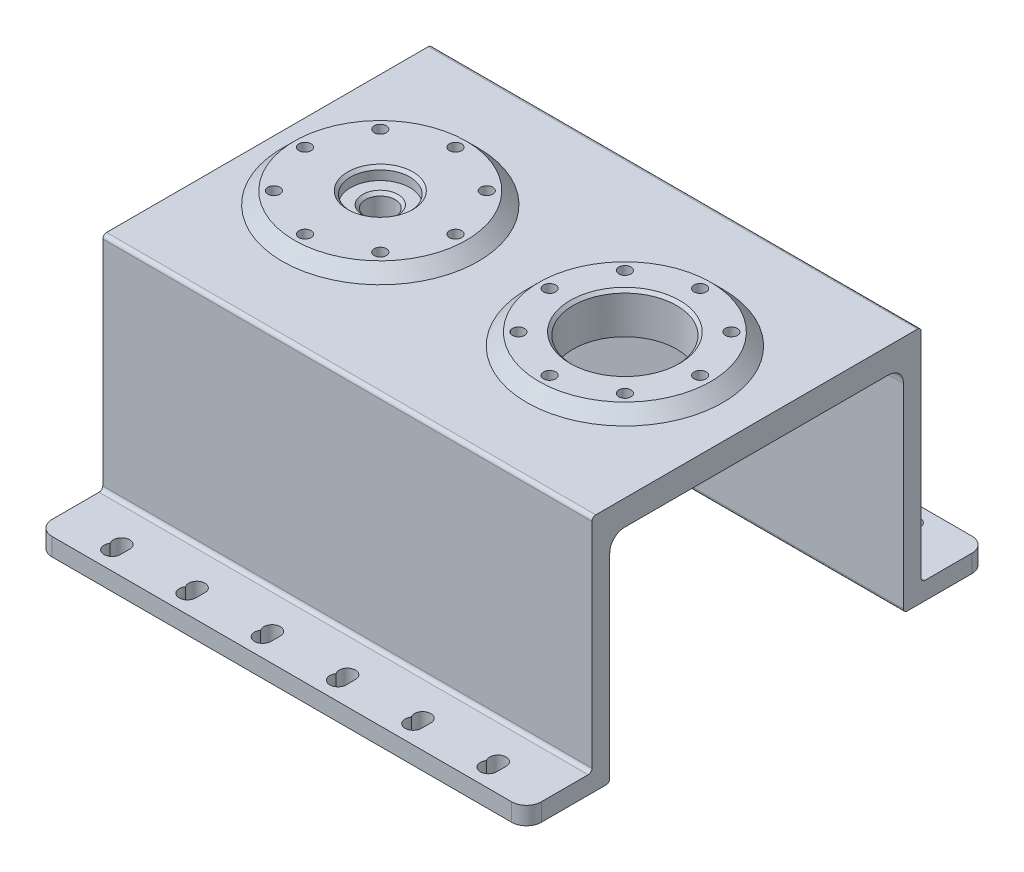
from build123d import *

# Parameters (mm, degrees)
BOSS_EXTRUDE1_DEPTH        = 44.45
BOSS_EXTRUDE1_DEPTH_BACK   = 120.65
SKETCH5_W                  = 99.125
SKETCH5_H                  = 72.176
BOSS_EXTRUDE2_DEPTH        = 1.5
CUT_EXTRUDE1_DEPTH         = 101.6
SKETCH12_R                 = 29
BOSS_EXTRUDE3_DEPTH        = 4.1
CHAMFER1_SIZE              = 4.1
SKETCH10_R                 = 2.05
CUT_EXTRUDE2_DEPTH         = 164.686388977
BOSS_EXTRUDE4_START        = -8.5
SKETCH17_R                 = 19.05
BOSS_EXTRUDE4_DEPTH        = 9.652
SKETCH13_R                 = 17.4625
CUT_EXTRUDE4_DEPTH         = 164.686388977
CHAMFER3_SIZE              = 1
LPATTERN1_COUNT            = 2
LPATTERN1_PITCH            = 82.55
CHAMFER1_OF_LPATTERN1_SIZE = 4.1
SKETCH14_R                 = 5
CUT_EXTRUDE5_DEPTH         = 164.686388977
SKETCH15_R                 = 10
CUT_EXTRUDE6_DEPTH         = 4.1
FILLET1_R                  = 1.27
FILLET3_R                  = 5
CHAMFER4_SIZE              = 1
CHAMFER5_SIZE              = 3
CHAMFER5_SIZE2             = 2.517298894


# Some blends are built 0.0001 mm under size
with BuildPart() as part:
    # Sketch2 → Boss-Extrude1 (new, two sides: drawn at the far end of the back side and taken through both)
    with BuildSketch(Plane(origin=(0, 0, 0), x_dir=(0, 0, -1), z_dir=(1, 0, 0)).offset(-BOSS_EXTRUDE1_DEPTH_BACK)):
        Polygon((-77.6605, 0), (-55.5625, 0), (-55.5625, 74.676), (55.5625, 74.676), (55.5625, 0), (77.6605, 0), (77.6605, -6), (49.5625, -6), (49.5625, 66.176), (-49.5625, 66.176), (-49.5625, -6), (-77.6605, -6), align=None)
    extrude(amount=BOSS_EXTRUDE1_DEPTH + BOSS_EXTRUDE1_DEPTH_BACK)

    # Sketch5 → Boss-Extrude2 (add)
    with BuildSketch(Plane.ZY.offset(120.65)):
        with Locations((0, 30.088)):
            Rectangle(SKETCH5_W, SKETCH5_H)
    extrude(amount=-BOSS_EXTRUDE2_DEPTH)

    # Sketch4 → Cut-Extrude1 (cut)
    with BuildSketch(Plane(origin=(0, 0, 0), x_dir=(1, 0, 0), z_dir=(0, 1, 0))):
        with BuildLine():
            Line((-98.85, 68.2625), (-98.85, 71.4375))
            ThreePointArc((-98.85, 71.4375), (-102.432865533, 74.058346238), (-103.845516366, 69.85))
            ThreePointArc((-103.845516366, 69.85), (-102.432865533, 65.641653762), (-98.85, 68.2625))
        make_face()
        with BuildLine():
            Line((-73.45, 68.2625), (-73.45, 71.4375))
            ThreePointArc((-73.45, 71.4375), (-77.032865533, 74.058346238), (-78.445516366, 69.85))
            ThreePointArc((-78.445516366, 69.85), (-77.032865533, 65.641653762), (-73.45, 68.2625))
        make_face()
        with BuildLine():
            Line((-48.05, 68.2625), (-48.05, 71.4375))
            ThreePointArc((-48.05, 71.4375), (-51.632865533, 74.058346238), (-53.045516366, 69.85))
            ThreePointArc((-53.045516366, 69.85), (-51.632865533, 65.641653762), (-48.05, 68.2625))
        make_face()
        with BuildLine():
            Line((-22.65, 68.2625), (-22.65, 71.4375))
            ThreePointArc((-22.65, 71.4375), (-26.232865533, 74.058346238), (-27.645516366, 69.85))
            ThreePointArc((-27.645516366, 69.85), (-26.232865533, 65.641653762), (-22.65, 68.2625))
        make_face()
        with BuildLine():
            Line((2.75, 68.2625), (2.75, 71.4375))
            ThreePointArc((2.75, 71.4375), (-0.832865533, 74.058346238), (-2.245516366, 69.85))
            ThreePointArc((-2.245516366, 69.85), (-0.832865533, 65.641653762), (2.75, 68.2625))
        make_face()
        with BuildLine():
            Line((28.15, 68.2625), (28.15, 71.4375))
            ThreePointArc((28.15, 71.4375), (24.567134467, 74.058346238), (23.154483634, 69.85))
            ThreePointArc((23.154483634, 69.85), (24.567134467, 65.641653762), (28.15, 68.2625))
        make_face()
    cut_extrude1 = extrude(amount=-CUT_EXTRUDE1_DEPTH, mode=Mode.SUBTRACT)

    # Mirror1: Cut-Extrude1 across plane
    add(cut_extrude1.mirror(Plane.XY), mode=Mode.SUBTRACT)

    # Sketch12 → Boss-Extrude3 (add)
    with BuildSketch(Plane(origin=(0, 74.676, 0), x_dir=(1, 0, 0), z_dir=(0, 1, 0))):
        with Locations(Location((0, 0, 0), (0, 0, 270))):
            Circle(SKETCH12_R)
    boss_extrude3 = extrude(amount=BOSS_EXTRUDE3_DEPTH)

    # Chamfer1
    chamfer1_edges = [part.edges().sort_by_distance(p)[0] for p in [
        (0, 74.676, -29),
    ]]
    chamfer(chamfer1_edges, length=CHAMFER1_SIZE - 0.0001)  # a hair under: the kernel refuses the full size

    # Sketch10 → Cut-Extrude2 (cut, symmetric)
    with BuildSketch(Plane(origin=(0, 0, 0), x_dir=(1, 0, 0), z_dir=(0, 1, 0))):
        with Locations(Location((17.960512242, 17.960512242, 0), (0, 0, 270))):
            Circle(SKETCH10_R)
        with Locations(Location((25.4, 0, 0), (0, 0, 270))):
            Circle(SKETCH10_R)
        with Locations(Location((17.960512242, -17.960512242, 0), (0, 0, 270))):
            Circle(SKETCH10_R)
        with Locations(Location((0, -25.4, 0), (0, 0, 270))):
            Circle(SKETCH10_R)
        with Locations(Location((-17.960512242, -17.960512242, 0), (0, 0, 270))):
            Circle(SKETCH10_R)
        with Locations(Location((-25.4, 0, 0), (0, 0, 270))):
            Circle(SKETCH10_R)
        with Locations(Location((-17.960512242, 17.960512242, 0), (0, 0, 270))):
            Circle(SKETCH10_R)
        with Locations(Location((0, 25.4, 0), (0, 0, 270))):
            Circle(SKETCH10_R)
    cut_extrude2 = extrude(amount=CUT_EXTRUDE2_DEPTH, both=True, mode=Mode.SUBTRACT)

    # Sketch17 → Boss-Extrude4 (add)
    with BuildSketch(Plane.XZ.offset(-66.176).offset(BOSS_EXTRUDE4_START)):
        with Locations(Location((0, 0, 0), (0, 0, 90))):
            Circle(SKETCH17_R)
    extrude(amount=BOSS_EXTRUDE4_DEPTH)

    # Sketch13 → Cut-Extrude4 (cut, through all)
    with BuildSketch(Plane(origin=(0, 0, 0), x_dir=(1, 0, 0), z_dir=(0, 1, 0))):
        with Locations(Location((0, 0, 0), (0, 0, 90))):
            Circle(SKETCH13_R)
    extrude(amount=CUT_EXTRUDE4_DEPTH, mode=Mode.SUBTRACT)

    # Chamfer3
    chamfer3_edges = [part.edges().sort_by_distance(p)[0] for p in [
        (0, 66.176, -19.05),
    ]]
    chamfer(chamfer3_edges, length=CHAMFER3_SIZE)

    # LPattern1: Boss-Extrude3, Cut-Extrude2 ×2
    with Locations(*[(-i * LPATTERN1_PITCH, 0, 0) for i in range(1, LPATTERN1_COUNT)]):
        add(boss_extrude3)
        add(cut_extrude2, mode=Mode.SUBTRACT)

    # Chamfer1 of LPattern1
    chamfer1_of_lpattern1_edges = [part.edges().sort_by_distance(p)[0] for p in [
        (-82.55, 74.676, -29),
    ]]
    chamfer(chamfer1_of_lpattern1_edges, length=CHAMFER1_OF_LPATTERN1_SIZE - 0.0001)  # a hair under: the kernel refuses the full size

    # Sketch14 → Cut-Extrude5 (cut, through all)
    with BuildSketch(Plane(origin=(0, 0, 0), x_dir=(1, 0, 0), z_dir=(0, 1, 0))):
        with Locations(Location((-82.55, 0, 0), (0, 0, 270))):
            Circle(SKETCH14_R)
    extrude(amount=CUT_EXTRUDE5_DEPTH, mode=Mode.SUBTRACT)

    # Sketch15 → Cut-Extrude6 (cut)
    with BuildSketch(Plane(origin=(0, 78.776, 0), x_dir=(1, 0, 0), z_dir=(0, 1, 0))):
        with Locations(Location((-82.55, 0, 0), (0, 0, 270))):
            Circle(SKETCH15_R)
    extrude(amount=-CUT_EXTRUDE6_DEPTH, mode=Mode.SUBTRACT)

    # Fillet1
    fillet1_edges = [part.edges().sort_by_distance(p)[0] for p in [
        (-38.1, 0, -55.5625),
        (-38.1, 74.676, -55.5625),
        (-38.1, 74.676, 55.5625),
        (-38.1, 0, 55.5625),
        (-37.35, -6, 49.5625),
        (-37.35, -6, -49.5625),
    ]]
    fillet(fillet1_edges, radius=FILLET1_R)

    # Fillet3
    # the kernel refuses this fillet: 5 mm, written as the material it adds along each edge
    with BuildSketch(Plane(origin=(-114.15, 61.176, 44.5625), x_dir=(0, 1, 0), z_dir=(-1, 0, 0))) as fillet3_piece_1_section:
        Polygon((0, 0), (FILLET3_R * 1.02, 0), (FILLET3_R * 1.02, -FILLET3_R * 1.02), (0, -FILLET3_R * 1.02), align=None)
    fillet3_piece_1 = extrude(amount=FILLET3_R * 1.02, mode=Mode.PRIVATE)
    fillet3_piece_1 = fillet3_piece_1 - Plane(origin=(-114.15, 61.176, 44.5625), x_dir=(0, -0.7071067811865475, -0.7071067811865475), z_dir=(-1, 0, 0)) * Sphere(FILLET3_R, mode=Mode.PRIVATE)
    add(fillet3_piece_1)
    with BuildSketch(Plane(origin=(-114.15, 61.176, -44.5625), x_dir=(-1, 0, 0), z_dir=(0, 1, 0))) as fillet3_piece_2_section:
        Polygon((0, 0), (FILLET3_R * 1.02, 0), (FILLET3_R * 1.02, -FILLET3_R * 1.02), (0, -FILLET3_R * 1.02), align=None)
    fillet3_piece_2 = extrude(amount=FILLET3_R * 1.02, mode=Mode.PRIVATE)
    fillet3_piece_2 = fillet3_piece_2 - Plane(origin=(-114.15, 61.176, -44.5625), x_dir=(0.7071067811865475, 0, 0.7071067811865475), z_dir=(0, 1, 0)) * Sphere(FILLET3_R, mode=Mode.PRIVATE)
    add(fillet3_piece_2)
    with BuildSketch(Plane(origin=(-119.15, -4.73, 49.5625), x_dir=(1, 0, 0), z_dir=(0, 1, 0))) as fillet3_piece_3:
        with BuildLine():
            CenterArc((FILLET3_R, FILLET3_R), FILLET3_R, 180, 90)
            Line((0, FILLET3_R), (0, 0))
            Line((0, 0), (FILLET3_R, 0))
        make_face()
    extrude(amount=65.906)
    with BuildSketch(Plane(origin=(-119.15, -4.73, -50.8325), x_dir=(0, 0.006283143965557515, 0.9999802608561371), z_dir=(0, -0.9999802608561371, 0.006283143965557515))) as fillet3_piece_4_section:
        with BuildLine():
            CenterArc((-1.27 - FILLET3_R, -FILLET3_R), FILLET3_R, 0, 90)
            Line((-1.27 - FILLET3_R, 0), (-1.27, 0))
            Line((-1.27, 0), (-1.27, -FILLET3_R))
        make_face()
    fillet3_piece_4 = revolve(axis=Axis((-119.15, -4.73, -50.8325), (-1, 0, 0)), revolution_arc=359.64, mode=Mode.PRIVATE)
    fillet3_piece_4 = split(fillet3_piece_4, bisect_by=Plane(origin=(-117.187917089, -6, -49.859640049), z_dir=(0, 1, 0)), keep=Keep.TOP, mode=Mode.PRIVATE)
    add(fillet3_piece_4)
    with BuildSketch(Plane(origin=(-119.15, -4.73, 50.8325), x_dir=(0, 0.006283143965559613, -0.9999802608561371), z_dir=(0, -0.9999802608561371, -0.006283143965559613))) as fillet3_piece_5_section:
        with BuildLine():
            CenterArc((-1.27 - FILLET3_R, FILLET3_R), FILLET3_R, 270, 90)
            Line((-1.27 - FILLET3_R, 0), (-1.27, 0))
            Line((-1.27, 0), (-1.27, FILLET3_R))
        make_face()
    fillet3_piece_5 = revolve(axis=Axis((-119.15, -4.73, 50.8325), (1, 0, 0)), revolution_arc=359.64, mode=Mode.PRIVATE)
    fillet3_piece_5 = split(fillet3_piece_5, bisect_by=Plane(origin=(-117.187917089, -6, 49.85964009), z_dir=(0, 1, 0)), keep=Keep.TOP, mode=Mode.PRIVATE)
    add(fillet3_piece_5)
    with BuildSketch(Plane(origin=(44.45, 66.176, 49.5625), x_dir=(0, 0, -1), z_dir=(-1, 0, 0))) as fillet3_piece_6:
        with BuildLine():
            CenterArc((FILLET3_R, FILLET3_R), FILLET3_R, 180, 90)
            Line((0, FILLET3_R), (0, 0))
            Line((0, 0), (FILLET3_R, 0))
        make_face()
    extrude(amount=158.6)
    with BuildSketch(Plane(origin=(44.45, 66.176, -49.5625), x_dir=(0, 0, 1), z_dir=(-1, 0, 0))) as fillet3_piece_7:
        with BuildLine():
            CenterArc((FILLET3_R, -FILLET3_R), FILLET3_R, 90, 90)
            Line((0, -FILLET3_R), (0, 0))
            Line((0, 0), (FILLET3_R, 0))
        make_face()
    extrude(amount=158.6)
    with BuildSketch(Plane(origin=(-119.15, 61.176, -49.5625), x_dir=(0, 0, 1), z_dir=(0, -1, 0))) as fillet3_piece_8:
        with BuildLine():
            CenterArc((FILLET3_R, -FILLET3_R), FILLET3_R, 90, 90)
            Line((0, -FILLET3_R), (0, 0))
            Line((0, 0), (FILLET3_R, 0))
        make_face()
    extrude(amount=65.906)
    with BuildSketch(Plane(origin=(-119.15, 66.176, 44.5625), x_dir=(1, 0, 0), z_dir=(0, 0, -1))) as fillet3_piece_9:
        with BuildLine():
            CenterArc((FILLET3_R, FILLET3_R), FILLET3_R, 180, 90)
            Line((0, FILLET3_R), (0, 0))
            Line((0, 0), (FILLET3_R, 0))
        make_face()
    extrude(amount=89.125)
    # the kernel refuses this fillet: 5 mm, written as the material it takes off along each edge
    with BuildSketch(Plane(origin=(-120.65, 12.5, -77.6605), x_dir=(0, 0, 1), z_dir=(0, -1, 0)), Plane(origin=(-120.65, -18.5, 77.6605), x_dir=(0, 0, -1), z_dir=(0, 1, 0))) as fillet3_2_piece_1:
        with BuildLine():
            CenterArc((FILLET3_R, -FILLET3_R), FILLET3_R, 90, 90)
            Line((0, -FILLET3_R), (0, 0))
            Line((0, 0), (FILLET3_R, 0))
        make_face()
    extrude(amount=31, mode=Mode.SUBTRACT)
    with BuildSketch(Plane(origin=(44.45, -18.5, 77.6605), x_dir=(0, 0, -1), z_dir=(0, 1, 0)), Plane(origin=(44.45, 12.5, -77.6605), x_dir=(0, 0, 1), z_dir=(0, -1, 0))) as fillet3_2_piece_2:
        with BuildLine():
            CenterArc((FILLET3_R, FILLET3_R), FILLET3_R, 180, 90)
            Line((0, FILLET3_R), (0, 0))
            Line((0, 0), (FILLET3_R, 0))
        make_face()
    extrude(amount=31, mode=Mode.SUBTRACT)

    # Chamfer4
    chamfer4_edges = [part.edges().sort_by_distance(p)[0] for p in [
        (0, 78.776, 17.4625),
        (-82.55, 66.176, -5),
        (-82.55, 74.676, -5),
        (-82.55, 78.776, -10),
    ]]
    chamfer(chamfer4_edges, length=CHAMFER4_SIZE)

    # Sketch19 → Revolve1 (revolve)
    with BuildSketch(Plane(origin=(0, 0, 0), x_dir=(0, 0, -1), z_dir=(1, 0, 0)), mode=Mode.PRIVATE) as revolve1_sk:
        Polygon((30, 66.176), (30, 62.121804358), (40, 62.821072478), (40, 66.176), align=None)
    revolve(revolve1_sk.sketch.rotate(Axis((0, 83.1148, 0), (0, -1, 0)), 180), axis=Axis((0, 83.1148, 0), (0, -1, 0)))

    # Chamfer5
    chamfer5_edges = [part.edges().sort_by_distance(p)[0] for p in [
        (0, 66.176, -40),
    ]]
    chamfer5_side = [part.faces().sort_by_distance(p)[0] for p in [
        (0, 64.498536239, -40),
    ]]
    chamfer(chamfer5_edges, length=CHAMFER5_SIZE, length2=CHAMFER5_SIZE2, reference=chamfer5_side[0])


solid = part.part
